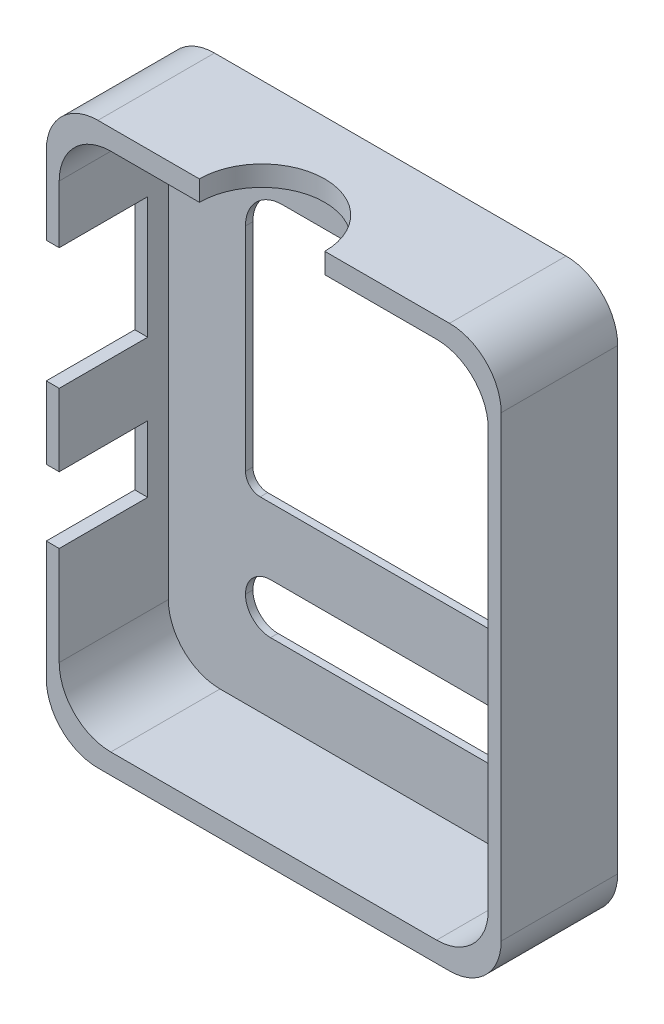
from build123d import *

# Parameters (mm, degrees)
SKETCH1_W                  = 61.658
SKETCH1_H                  = 76.028
BOSS_EXTRUDE1_DEPTH        = 15.8
SKETCH3_W                  = 58.158
SKETCH3_H                  = 70.528
CUT_EXTRUDE2_DEPTH         = 14.8
FILLET1_R                  = 7
FILLET2_R                  = 7
FILLET3_R                  = 7
SKETCH4_W                  = 1.75
SKETCH4_H                  = 16.5
CUT_EXTRUDE3_SWITCH_DEPTH  = 12
SKETCH5_W                  = 1.75
SKETCH5_H                  = 9
CUT_EXTRUDE4_USB_DEPTH     = 12
SKETCH6_R                  = 8.5
CUT_EXTRUDE4_SONIC_DEPTH   = 2.75
SKETCH7_W                  = 37.258
SKETCH7_H                  = 35.8
CUT_EXTRUDE5_LCDMAIN_DEPTH = 1
SKETCH8_W                  = 37.258
SKETCH8_H                  = 6.8
CUT_EXTRUDE6_LCDNOTI_DEPTH = 1
FILLET4_R                  = 5
FILLET5_R                  = 2
FILLET6_R                  = 3.4


with BuildPart() as part:
    # Sketch1 → Boss-Extrude1 (new body)
    with BuildSketch(Plane.XY):
        with Locations((30.829, 38.014)):
            Rectangle(SKETCH1_W, SKETCH1_H)
    extrude(amount=BOSS_EXTRUDE1_DEPTH)

    # Sketch3 → Cut-Extrude2 (cut)
    with BuildSketch(Plane.XY.offset(15.8)):
        with Locations((30.829, 38.014)):
            Rectangle(SKETCH3_W, SKETCH3_H)
    extrude(amount=-CUT_EXTRUDE2_DEPTH, mode=Mode.SUBTRACT)

    # Fillet1
    fillet1_edges = [part.edges().sort_by_distance(p)[0] for p in [
        (61.658, 76.028, 7.9),
    ]]
    fillet(fillet1_edges, radius=FILLET1_R)

    # Fillet2
    fillet2_edges = [part.edges().sort_by_distance(p)[0] for p in [
        (1.75, 73.278, 8.4),
        (61.658, 0, 7.9),
        (0, 0, 7.9),
    ]]
    fillet(fillet2_edges, radius=FILLET2_R)

    # Fillet3
    fillet3_edges = [part.edges().sort_by_distance(p)[0] for p in [
        (1.75, 2.75, 8.4),
        (59.908, 73.278, 8.4),
        (59.908, 2.75, 8.4),
        (0, 76.028, 7.9),
    ]]
    fillet(fillet3_edges, radius=FILLET3_R)

    # Sketch4 → Cut-Extrude3_switch (cut)
    with BuildSketch(Plane.XY.offset(15.8)):
        with Locations((0.875, 50.194669907)):
            Rectangle(SKETCH4_W, SKETCH4_H)
    extrude(amount=-CUT_EXTRUDE3_SWITCH_DEPTH, mode=Mode.SUBTRACT)

    # Sketch5 → Cut-Extrude4_usb (cut)
    with BuildSketch(Plane.XY.offset(15.8)):
        with Locations((0.875, 27.643981113)):
            Rectangle(SKETCH5_W, SKETCH5_H)
    extrude(amount=-CUT_EXTRUDE4_USB_DEPTH, mode=Mode.SUBTRACT)

    # Sketch6 → Cut-Extrude4_sonic (cut)
    with BuildSketch(Plane(origin=(0, 76.028, 0), x_dir=(1, 0, 0), z_dir=(0, 1, 0))):
        with Locations((29.25, -15.8)):
            Circle(SKETCH6_R)
    extrude(amount=-CUT_EXTRUDE4_SONIC_DEPTH, mode=Mode.SUBTRACT)

    # Sketch7 → Cut-Extrude5_LcdMain (cut)
    with BuildSketch(Plane(origin=(0, 0, 0), x_dir=(-1, 0, 0), z_dir=(0, 0, -1))):
        with Locations((-30.829, 45.928)):
            Rectangle(SKETCH7_W, SKETCH7_H)
    extrude(amount=-CUT_EXTRUDE5_LCDMAIN_DEPTH, mode=Mode.SUBTRACT)

    # Sketch8 → Cut-Extrude6_LcdNoti (cut)
    with BuildSketch(Plane(origin=(0, 0, 0), x_dir=(-1, 0, 0), z_dir=(0, 0, -1))):
        with Locations((-30.829, 15.6)):
            Rectangle(SKETCH8_W, SKETCH8_H)
    extrude(amount=-CUT_EXTRUDE6_LCDNOTI_DEPTH, mode=Mode.SUBTRACT)

    # Fillet4
    fillet4_edges = [part.edges().sort_by_distance(p)[0] for p in [
        (49.458, 63.828, 0.5),
        (12.2, 63.828, 0.5),
    ]]
    fillet(fillet4_edges, radius=FILLET4_R)

    # Fillet5
    fillet5_edges = [part.edges().sort_by_distance(p)[0] for p in [
        (49.458, 28.028, 0.5),
        (12.2, 28.028, 0.5),
    ]]
    fillet(fillet5_edges, radius=FILLET5_R)

    # Fillet6
    fillet6_edges = [part.edges().sort_by_distance(p)[0] for p in [
        (12.2, 12.2, 0.5),
        (12.2, 19, 0.5),
        (49.458, 19, 0.5),
        (49.458, 12.2, 0.5),
    ]]
    fillet(fillet6_edges, radius=FILLET6_R - 0.0001)  # a hair under: the kernel refuses the full size


solid = part.part
